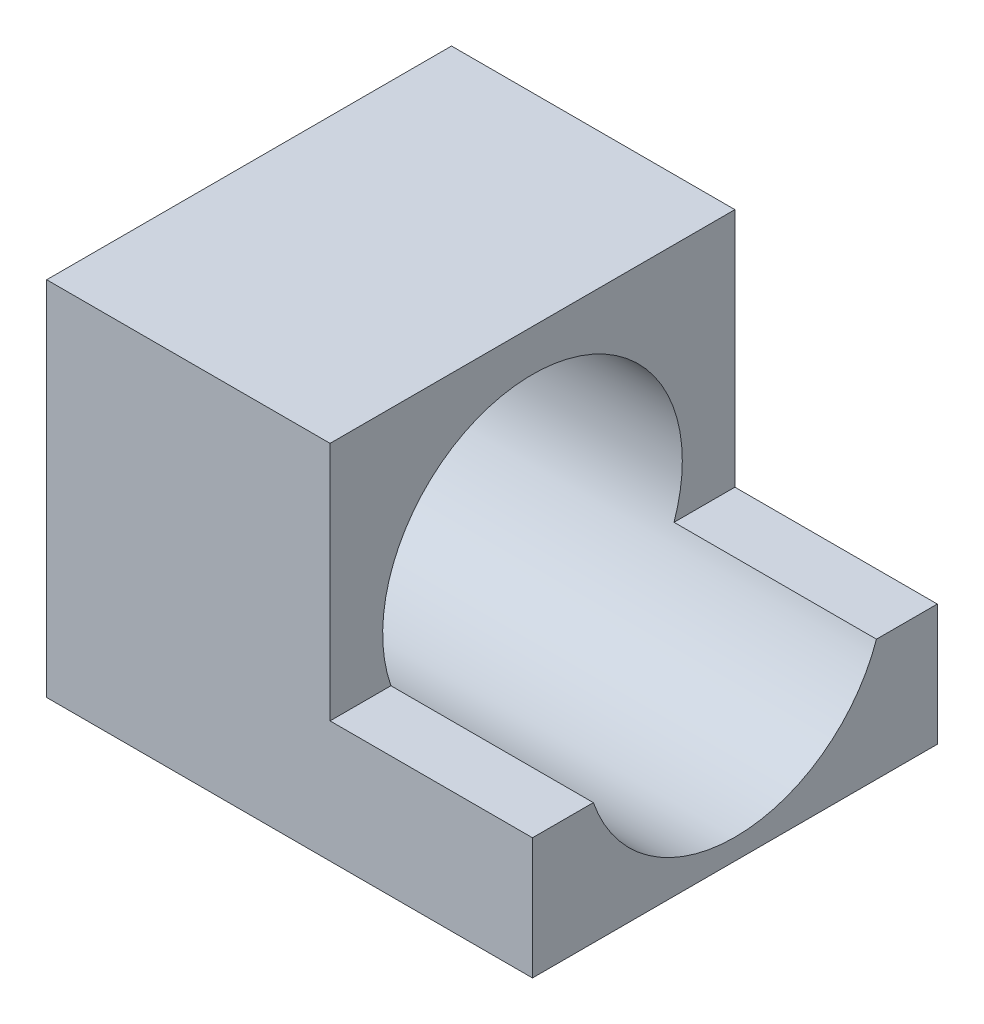
from build123d import *

# Parameters (mm, degrees)
SKETCH1_W              = 60.96
SKETCH1_H              = 50.8
BOSS_EXTRUDE1_DEPTH    = 40.64
SKETCH3_W              = 60.96
SKETCH3_H              = 50.8
BOSS_EXTRUDE2_DEPTH    = 1.5875
SKETCH2_R              = 18.8
CUT_EXTRUDE1_DEPTH     = 57.785
SKETCH4_W              = 60.96
SKETCH4_H              = 50.8
BOSS_EXTRUDE3_DEPTH    = 3.175
SKETCH6_R              = 9.144
CUT_EXTRUDE2_DEPTH     = 3.175
SKETCH7_R              = 1.5
CUT_EXTRUDE3_DEPTH     = 3.175
SKETCH8_R              = 4.7625
BOSS_EXTRUDE4_DEPTH    = 8.89
CUT_EXTRUDE4_START     = -7.1501
CUT_EXTRUDE4_OUTLINE_R = 4.7625
CUT_EXTRUDE4_DEPTH     = 0.7366
SKETCH9_R              = 4.4704
BOSS_EXTRUDE5_DEPTH    = 0.7366
SKETCH13_R             = 2.54
CUT_EXTRUDE6_DEPTH     = 3.175
SKETCH14_W             = 50.8
SKETCH14_H             = 30.1625
CUT_EXTRUDE7_DEPTH     = 25.4


# Read off the part's stored shape, not the designer's step: Cut-Extrude4
with BuildPart() as part:
    # Sketch1 → Boss-Extrude1 (new body)
    with BuildSketch(Plane(origin=(0, 0, 0), x_dir=(1, 0, 0), z_dir=(0, 1, 0))):
        Rectangle(SKETCH1_W, SKETCH1_H)
    extrude(amount=BOSS_EXTRUDE1_DEPTH)

    # Sketch3 → Boss-Extrude2 (add)
    with BuildSketch(Plane(origin=(0, 0, 0), x_dir=(-1, 0, 0), z_dir=(0, -1, 0))):
        Rectangle(SKETCH3_W, SKETCH3_H)
    extrude(amount=BOSS_EXTRUDE2_DEPTH)

    # Sketch2 → Cut-Extrude1 (cut)
    with BuildSketch(Plane(origin=(30.48, 0, 0), x_dir=(0, 0, -1), z_dir=(1, 0, 0))):
        with Locations((0, 19.812)):
            Circle(SKETCH2_R)
    extrude(amount=-CUT_EXTRUDE1_DEPTH, mode=Mode.SUBTRACT)

    # Sketch4 → Boss-Extrude3 (add)
    with BuildSketch(Plane(origin=(0, 40.64, 0), x_dir=(1, 0, 0), z_dir=(0, 1, 0))):
        Rectangle(SKETCH4_W, SKETCH4_H)
    extrude(amount=BOSS_EXTRUDE3_DEPTH)

    # Sketch6 → Cut-Extrude2 (cut)
    with BuildSketch(Plane.ZY.offset(30.48)):
        with Locations((0, 19.812)):
            Circle(SKETCH6_R)
    extrude(amount=-CUT_EXTRUDE2_DEPTH, mode=Mode.SUBTRACT)

    # Sketch7 → Cut-Extrude3 (cut)
    with BuildSketch(Plane.ZY.offset(30.48)):
        with Locations((0, 32.312000019)):
            Circle(SKETCH7_R)
        with Locations((0, 7.311999981)):
            Circle(SKETCH7_R)
    extrude(amount=-CUT_EXTRUDE3_DEPTH, mode=Mode.SUBTRACT)

    # Sketch8 → Boss-Extrude4 (add)
    with BuildSketch(Plane.XZ.offset(1.5875)):
        with Locations(Location((0, 0, 0), (0, 0, 90))):
            Circle(SKETCH8_R)
    extrude(amount=BOSS_EXTRUDE4_DEPTH)

    # Cut-Extrude4 outline → Cut-Extrude4 (cut)
    with BuildSketch(Plane(origin=(0, 0, 0), x_dir=(1, 0, 0), z_dir=(0, 1, 0)).offset(CUT_EXTRUDE4_START)):
        Circle(CUT_EXTRUDE4_OUTLINE_R)
    extrude(amount=CUT_EXTRUDE4_DEPTH, mode=Mode.SUBTRACT)

    # Sketch9 → Boss-Extrude5 (add)
    with BuildSketch(Plane(origin=(0, -6.4135, 0), x_dir=(-1, 0, 0), z_dir=(0, -1, 0))):
        with Locations(Location((0, 0, 0), (0, 0, 90))):
            Circle(SKETCH9_R)
    extrude(amount=BOSS_EXTRUDE5_DEPTH)

    # Sketch13 → Cut-Extrude6 (cut)
    with BuildSketch(Plane.ZY.offset(30.48)):
        with Locations((8.838834778, 28.650834778)):
            Circle(SKETCH13_R)
        with Locations((-8.838834778, 28.650834778)):
            Circle(SKETCH13_R)
        with Locations((-8.838834778, 10.973165222)):
            Circle(SKETCH13_R)
        with Locations((8.838834778, 10.973165222)):
            Circle(SKETCH13_R)
    extrude(amount=-CUT_EXTRUDE6_DEPTH, mode=Mode.SUBTRACT)

    # Sketch14 → Cut-Extrude7 (cut)
    with BuildSketch(Plane(origin=(30.48, 0, 0), x_dir=(0, 0, -1), z_dir=(1, 0, 0))):
        with Locations((0, 28.73375)):
            Rectangle(SKETCH14_W, SKETCH14_H)
    extrude(amount=-CUT_EXTRUDE7_DEPTH, mode=Mode.SUBTRACT)


solid = part.part
